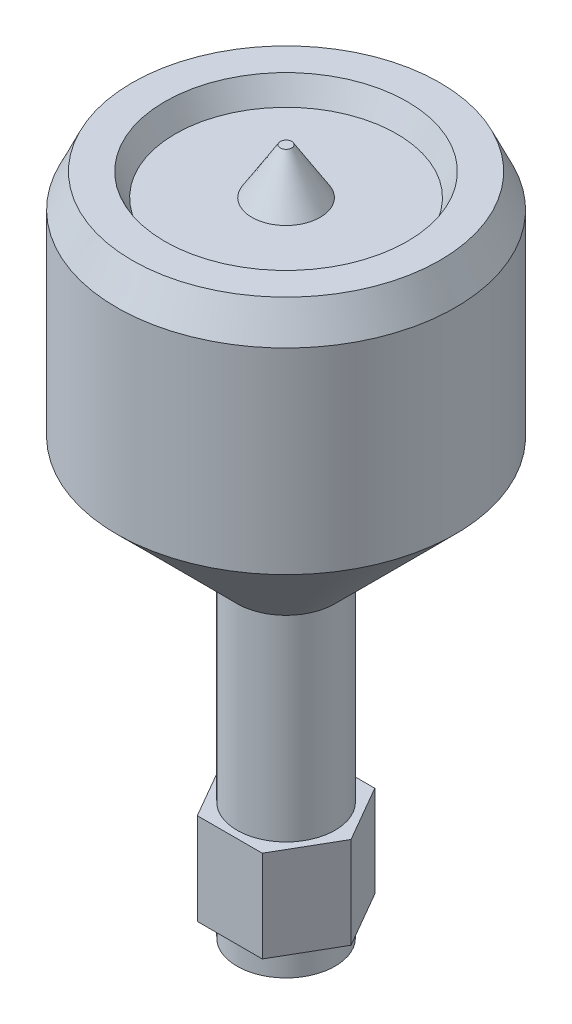
from build123d import *

# Parameters (mm, degrees)
SALIENTE_EXTRUIR1_START = -7
CROQUIS2_R              = 4.25
SALIENTE_EXTRUIR1_DEPTH = 7


# Read off the part's stored shape, not the designer's step: Partir1
with BuildPart() as part:
    # Croquis1 → Revolución1 (revolve)
    with BuildSketch(Plane.XY):
        Polygon((0, 0), (-3.75, 0), (-3.75, 2), (-4.25, 2), (-4.25, 9), (-3.75, 9), (-3.75, 24), (-12.942388155, 33.192388155), (-12.942388155, 48.192388155), (-11.761339552, 50.725155058), (-9.261339552, 50.725155058), (-8.455528943, 48.997088628), (-2.612378307, 48.997088628), (-0.434974261, 52.5), (0, 52.5), align=None)
    revolve(axis=Axis((0, 52.5, 0), (0, -1, 0)))

    # Croquis2 → Saliente-Extruir1 (add)
    with BuildSketch(Plane.XZ.offset(-2).offset(SALIENTE_EXTRUIR1_START)):
        Polygon((4.965212315, 0), (2.482606158, 4.3), (-2.482606158, 4.3), (-4.965212315, 0), (-2.482606158, -4.3), (2.482606158, -4.3), align=None)
        Circle(CROQUIS2_R, mode=Mode.SUBTRACT)
    extrude(amount=SALIENTE_EXTRUIR1_DEPTH)


with BuildPart() as body_2:
    # Partir1: the piece on the far side of the plane
    add(part.part)
    split(bisect_by=Plane(origin=(0, 9, 0), x_dir=(1, 0, 0), z_dir=(0, 1, 0)), keep=Keep.BOTTOM)


with BuildPart() as part_1:
    add(part.part)

    # Partir1
    split(bisect_by=Plane(origin=(0, 9, 0), x_dir=(1, 0, 0), z_dir=(0, 1, 0)), keep=Keep.TOP)


solid = Compound([body_2.part, part_1.part])
